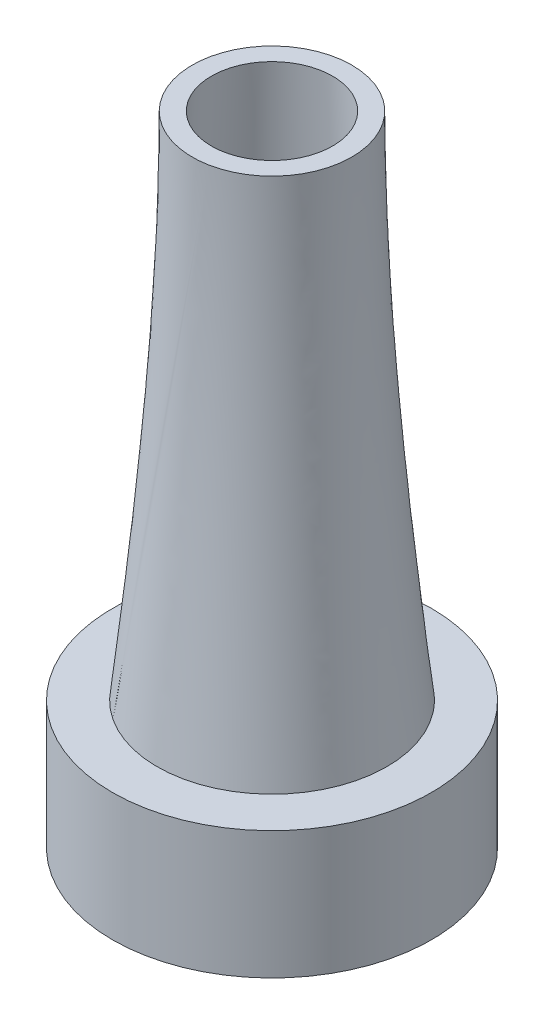
from build123d import *

# Parameters (mm, degrees)
CROQUIS1_R              = 25
SALIENTE_EXTRUIR1_DEPTH = 20
CROQUIS5_R              = 9.5
CORTAR_EXTRUIR1_DEPTH   = 80
CORTAR_EXTRUIR1_DRAFT   = 3


with BuildPart() as part:
    # Croquis1 → Saliente-Extruir1 (new body)
    with BuildSketch(Plane(origin=(0, 0, 0), x_dir=(1, 0, 0), z_dir=(0, 1, 0))):
        with Locations(Location((0, 0, 0), (0, 0, 270))):
            Circle(CROQUIS1_R)
    extrude(amount=SALIENTE_EXTRUIR1_DEPTH)

    # Recubrir1: read off the stored shape, not the designer's step
    # Recubrir1: loft between two sections, ruled curve by curve
    recubrir1_from = [
        Edge.make_bspline([(-9.844568518, 20, 15.069322171), (20.294075824, 20, 34.758459207), (39.98321286, 20, 4.619814865), (9.844568518, 20, -15.069322171), (-20.294075824, 20, -34.758459207), (-39.98321286, 20, -4.619814865), (-9.844568518, 20, 15.069322171)], [0, 0, 0, 0, 0.5, 0.5, 0.5, 1, 1, 1, 1], 3, [1, 0.333333333, 0.333333333, 1, 0.333333333, 0.333333333, 1]),
    ]
    recubrir1_to = [
        Edge.make_bspline([(2.388538874, 100, 12.269673266), (26.927885406, 100, 7.492595517), (22.150807657, 100, -17.046751015), (-2.388538874, 100, -12.269673266), (-26.927885406, 100, -7.492595517), (-22.150807657, 100, 17.046751015), (2.388538874, 100, 12.269673266)], [0, 0, 0, 0, 0.5, 0.5, 0.5, 1, 1, 1, 1], 3, [1, 0.333333333, 0.333333333, 1, 0.333333333, 0.333333333, 1]),
    ]
    recubrir1 = Solid(Shell([*[Face.make_surface_from_curves(recubrir1_from[k], recubrir1_to[k]) for k in range(1)], Face(Wire(recubrir1_from)), Face(Wire(recubrir1_to))]))
    add(recubrir1)


with BuildPart() as cortar_extruir1_tool:
    # Croquis5 → Cortar-Extruir1 (with draft: the straight prism first)
    with BuildSketch(Plane(origin=(0, 100, 0), x_dir=(1, 0, 0), z_dir=(0, 1, 0))):
        Circle(CROQUIS5_R)
    extrude(amount=-CORTAR_EXTRUIR1_DEPTH)
    # Cortar-Extruir1: the draft: its side faces are tilted about the plane it starts from
    cortar_extruir1_sides = [cortar_extruir1_tool.faces().sort_by_distance(p)[0] for p in [
        (-9.5, 60, 0),
    ]]
    draft(cortar_extruir1_sides, Plane(origin=(0, 100, 0), x_dir=(1, 0, 0), z_dir=(0, 1, 0)), CORTAR_EXTRUIR1_DRAFT)


with BuildPart() as part_1:
    add(part.part)

    # Cortar-Extruir1: cut by cortar_extruir1_tool
    add(cortar_extruir1_tool.part, mode=Mode.SUBTRACT)


solid = part_1.part
